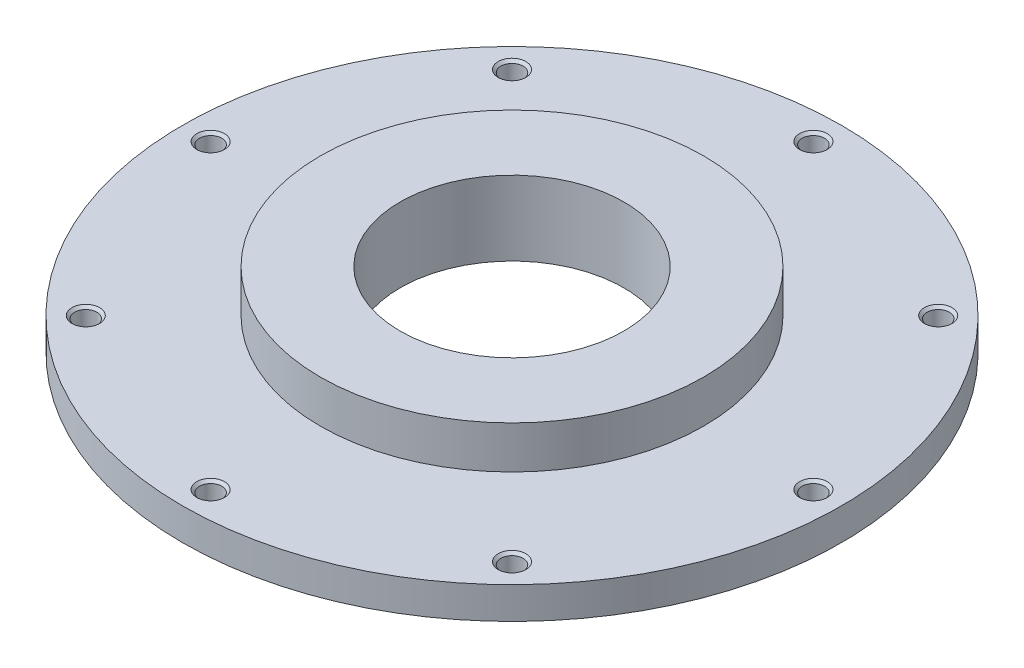
from build123d import *

# Parameters (mm, degrees)
SKETCH1_R                    = 62
SKETCH1_R_2                  = 21.05
BOSS_EXTRUDE1_DEPTH          = 6
SKETCH2_R                    = 36.05
SKETCH2_R_2                  = 21.05
BOSS_EXTRUDE2_DEPTH          = 8
SKETCH3_R                    = 2.1
CUT_EXTRUDE1_DEPTH           = 8
CHAMFER1_SIZE                = 0.5
CIRPATTERN1_COUNT            = 8
CHAMFER1_OF_CIRPATTERN1_SIZE = 0.5


with BuildPart() as part:
    # Sketch1 → Boss-Extrude1 (new body)
    with BuildSketch(Plane(origin=(0, 0, 0), x_dir=(1, 0, 0), z_dir=(0, 1, 0))):
        Circle(SKETCH1_R)
        Circle(SKETCH1_R_2, mode=Mode.SUBTRACT)
    extrude(amount=BOSS_EXTRUDE1_DEPTH)

    # Sketch2 → Boss-Extrude2 (add)
    with BuildSketch(Plane(origin=(0, 6, 0), x_dir=(1, 0, 0), z_dir=(0, 1, 0))):
        Circle(SKETCH2_R)
        Circle(SKETCH2_R_2, mode=Mode.SUBTRACT)
    extrude(amount=BOSS_EXTRUDE2_DEPTH)

    # Sketch3 → Cut-Extrude1 (cut)
    with BuildSketch(Plane(origin=(0, 6, 0), x_dir=(1, 0, 0), z_dir=(0, 1, 0))):
        with Locations((-56.7, 0)):
            Circle(SKETCH3_R)
    cut_extrude1 = extrude(amount=-CUT_EXTRUDE1_DEPTH, mode=Mode.SUBTRACT)

    # Chamfer1
    chamfer1_edges = [part.edges().sort_by_distance(p)[0] for p in [
        (-58.8, 6, 0),
    ]]
    chamfer(chamfer1_edges, length=CHAMFER1_SIZE)

    # CirPattern1: Cut-Extrude1 ×8 about axis
    cirpattern1_axis = Axis((0, 6, 0), (0, 1, 0))
    for i in range(1, CIRPATTERN1_COUNT):
        add(cut_extrude1.rotate(cirpattern1_axis, i * 360 / CIRPATTERN1_COUNT), mode=Mode.SUBTRACT)

    # Chamfer1 of CirPattern1
    chamfer1_of_cirpattern1_edges = [part.edges().sort_by_distance(p)[0] for p in [
        (-41.577878734, 6, 41.577878734),
        (0, 6, 58.8),
        (41.577878734, 6, 41.577878734),
        (58.8, 6, 0),
        (41.577878734, 6, -41.577878734),
        (0, 6, -58.8),
        (-41.577878734, 6, -41.577878734),
    ]]
    chamfer(chamfer1_of_cirpattern1_edges, length=CHAMFER1_OF_CIRPATTERN1_SIZE)


solid = part.part
